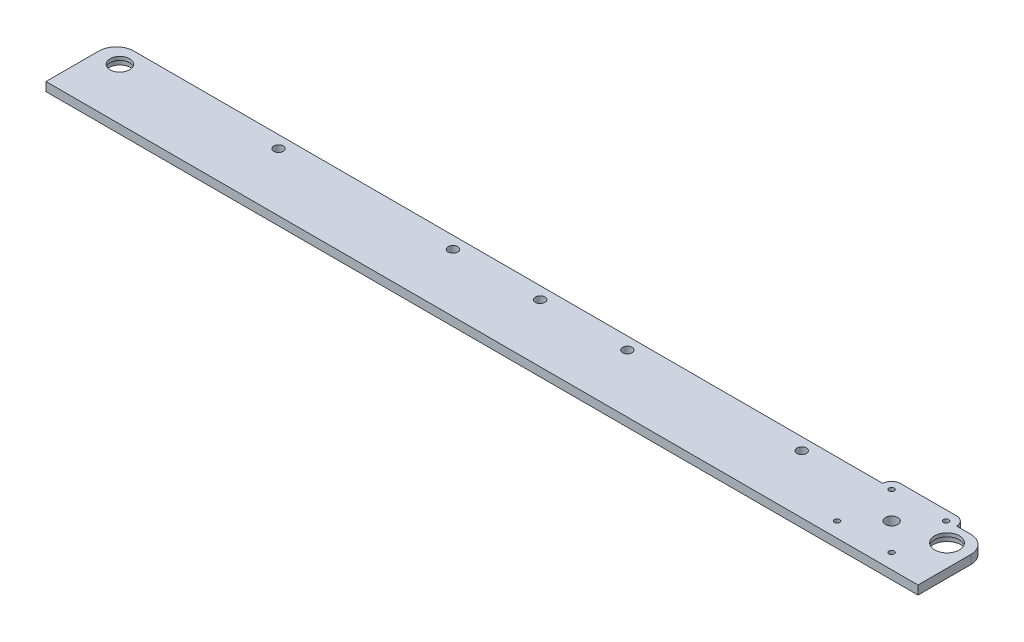
from build123d import *

# Parameters (mm, degrees)
SKETCH1_W           = 496
SKETCH1_H           = 40
SKETCH1_R           = 5.5
SKETCH1_R_2         = 7
SKETCH1_R_3         = 2.7
BOSS_EXTRUDE1_DEPTH = 5
SKETCH2_R           = 6.5
SKETCH2_R_2         = 8
CUT_EXTRUDE1_DEPTH  = 3
FILLET1_R           = 10
SKETCH3_W           = 42
SKETCH3_H           = 9.695245244
BOSS_EXTRUDE2_DEPTH = 5
SKETCH5_R           = 3.5
SKETCH5_R_2         = 1.5
CUT_EXTRUDE2_DEPTH  = 5
FILLET2_R           = 5
SKETCH6_R           = 3
CUT_EXTRUDE3_DEPTH  = 2


with BuildPart() as part:
    # Sketch1 → Boss-Extrude1 (new body)
    with BuildSketch(Plane(origin=(0, 0, 0), x_dir=(1, 0, 0), z_dir=(0, 1, 0))):
        with Locations((-144.299026304, 43.778006447)):
            Rectangle(SKETCH1_W, SKETCH1_H)
        with Locations(Location((-379.799026304, 53.278006447, 0), (0, 0, 270))):
            Circle(SKETCH1_R, mode=Mode.SUBTRACT)
        with Locations(Location((91.200973696, 52.778006447, 0), (0, 0, 270))):
            Circle(SKETCH1_R_2, mode=Mode.SUBTRACT)
        with Locations(Location((-293.099026304, 56.844673113, 0), (0, 0, 270))):
            Circle(SKETCH1_R_3, mode=Mode.SUBTRACT)
        with Locations(Location((-193.899026304, 56.844673113, 0), (0, 0, 270))):
            Circle(SKETCH1_R_3, mode=Mode.SUBTRACT)
        with Locations(Location((-94.699026304, 56.844673113, 0), (0, 0, 270))):
            Circle(SKETCH1_R_3, mode=Mode.SUBTRACT)
        with Locations(Location((4.500973696, 56.844673113, 0), (0, 0, 270))):
            Circle(SKETCH1_R_3, mode=Mode.SUBTRACT)
        with Locations(Location((-144.299026304, 56.844673113, 0), (0, 0, 270))):
            Circle(SKETCH1_R_3, mode=Mode.SUBTRACT)
    extrude(amount=BOSS_EXTRUDE1_DEPTH)

    # Sketch2 → Cut-Extrude1 (cut)
    with BuildSketch(Plane.XZ):
        with Locations(Location((-379.799026304, -53.278006447, 0), (0, 0, 270))):
            Circle(SKETCH2_R)
        with Locations(Location((91.200973696, -52.778006447, 0), (0, 0, 270))):
            Circle(SKETCH2_R_2)
    extrude(amount=-CUT_EXTRUDE1_DEPTH, mode=Mode.SUBTRACT)

    # Fillet1
    fillet1_edges = [part.edges().sort_by_distance(p)[0] for p in [
        (-392.299026304, 2.5, -63.778006447),
        (103.700973696, 2.5, -63.778006447),
    ]]
    fillet(fillet1_edges, radius=FILLET1_R)

    # Sketch3 → Boss-Extrude2 (add)
    with BuildSketch(Plane(origin=(0, 5, 0), x_dir=(1, 0, 0), z_dir=(0, 1, 0))):
        with Locations((64.667975373, 63.930383825)):
            Rectangle(SKETCH3_W, SKETCH3_H)
    extrude(amount=-BOSS_EXTRUDE2_DEPTH)

    # Sketch5 → Cut-Extrude2 (cut)
    with BuildSketch(Plane(origin=(0, 5, 0), x_dir=(1, 0, 0), z_dir=(0, 1, 0))):
        with Locations(Location((64.667975373, 47.778006447, 0), (0, 0, 270))):
            Circle(SKETCH5_R)
        with Locations(Location((49.167975373, 63.278006447, 0), (0, 0, 270))):
            Circle(SKETCH5_R_2)
        with Locations(Location((80.167975373, 63.278006447, 0), (0, 0, 270))):
            Circle(SKETCH5_R_2)
        with Locations(Location((80.167975373, 32.278006447, 0), (0, 0, 270))):
            Circle(SKETCH5_R_2)
        with Locations(Location((49.167975373, 32.278006447, 0), (0, 0, 270))):
            Circle(SKETCH5_R_2)
    extrude(amount=-CUT_EXTRUDE2_DEPTH, mode=Mode.SUBTRACT)

    # Fillet2
    fillet2_edges = [part.edges().sort_by_distance(p)[0] for p in [
        (43.667975373, 2.5, -68.778006447),
        (85.667975373, 2.5, -68.778006447),
    ]]
    fillet(fillet2_edges, radius=FILLET2_R - 0.0001)  # a hair under: the kernel refuses the full size

    # Sketch6 → Cut-Extrude3 (cut)
    with BuildSketch(Plane.XZ):
        with Locations(Location((49.167975373, -32.278006447, 0), (0, 0, 270))):
            Circle(SKETCH6_R)
        with Locations(Location((80.167975373, -32.278006447, 0), (0, 0, 270))):
            Circle(SKETCH6_R)
        with Locations(Location((49.167975373, -63.278006447, 0), (0, 0, 270))):
            Circle(SKETCH6_R)
        with Locations(Location((80.167975373, -63.278006447, 0), (0, 0, 270))):
            Circle(SKETCH6_R)
    extrude(amount=-CUT_EXTRUDE3_DEPTH, mode=Mode.SUBTRACT)


solid = part.part
